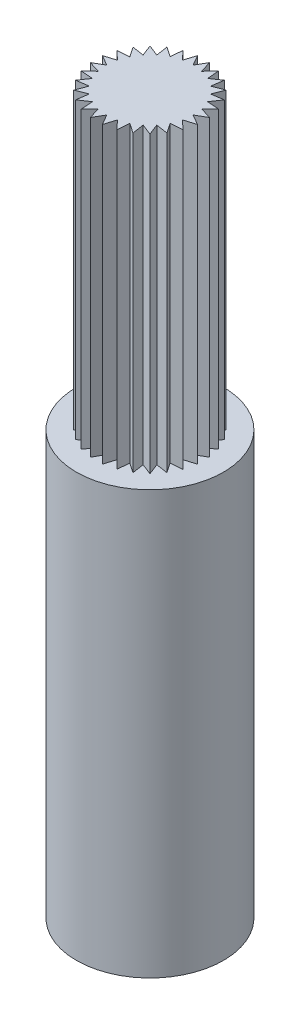
from build123d import *

# Parameters (mm, degrees)
SKETCH1_R           = 3.175
BOSS_EXTRUDE1_DEPTH = 18.000000068
SKETCH2_R           = 3.175
BOSS_EXTRUDE2_DEPTH = 0.254
SKETCH4_R           = 3.175
BOSS_EXTRUDE3_DEPTH = 12.7
CUT_EXTRUDE2_START  = -12.7
CUT_EXTRUDE2_DEPTH  = 12.7
CIRPATTERN1_COUNT   = 28


with BuildPart() as part:
    # Sketch1 → Boss-Extrude1 (new body)
    with BuildSketch(Plane(origin=(0, 0, 0), x_dir=(1, 0, 0), z_dir=(0, 1, 0))):
        Circle(SKETCH1_R)
        with BuildLine():
            Line((-1.855488288, -1.67829283), (1.855488288, -1.67829283))
            ThreePointArc((1.855488288, -1.67829283), (0, 2.5019), (-1.855488288, -1.67829283))
        make_face(mode=Mode.SUBTRACT)
    extrude(amount=BOSS_EXTRUDE1_DEPTH)

    # Sketch2 → Boss-Extrude2 (add)
    with BuildSketch(Plane(origin=(0, 18.000000068, 0), x_dir=(1, 0, 0), z_dir=(0, 1, 0))):
        Circle(SKETCH2_R)
    extrude(amount=BOSS_EXTRUDE2_DEPTH)

    # Sketch4 → Boss-Extrude3 (add)
    with BuildSketch(Plane(origin=(0, 18.254000068, 0), x_dir=(1, 0, 0), z_dir=(0, 1, 0))):
        Circle(SKETCH4_R)
    extrude(amount=BOSS_EXTRUDE3_DEPTH)

    # Sketch5 → Cut-Extrude2 (cut)
    with BuildSketch(Plane(origin=(0, 30.954000068, 0), x_dir=(1, 0, 0), z_dir=(0, 1, 0)).offset(CUT_EXTRUDE2_START)):
        with BuildLine():
            Line((0, 1.862485999), (0.7112, 3.094320533))
            ThreePointArc((0.7112, 3.094320533), (0, 3.175), (-0.7112, 3.094320533))
            Line((-0.7112, 3.094320533), (0, 1.862485999))
        make_face()
    cut_extrude2 = extrude(amount=CUT_EXTRUDE2_DEPTH, mode=Mode.SUBTRACT)

    # CirPattern1: Cut-Extrude2 ×28 about axis
    cirpattern1_axis = Axis((0, 30.954000068, 0), (0, 1, 0))
    for i in range(1, CIRPATTERN1_COUNT):
        add(cut_extrude2.rotate(cirpattern1_axis, i * 360 / CIRPATTERN1_COUNT), mode=Mode.SUBTRACT)


solid = part.part
